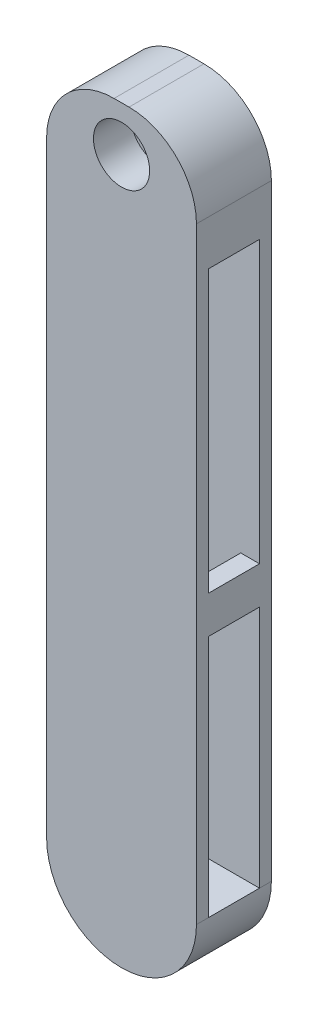
from build123d import *

# Parameters (mm, degrees)
SKETCH2_W           = 40
SKETCH2_H           = 200
BOSS_EXTRUDE1_DEPTH = 20
SKETCH3_R           = 2
CUT_EXTRUDE1_DEPTH  = 10
FILLET1_R           = 20
SKETCH5_R           = 7.5
CUT_EXTRUDE3_DEPTH  = 10
FILLET2_R           = 18
SKETCH6_W           = 13.65
SKETCH6_H           = 150
CUT_EXTRUDE4_DEPTH  = 110.544511501
SKETCH7_W           = 5
SKETCH7_H           = 10
BOSS_EXTRUDE2_DEPTH = 15


with BuildPart() as part:
    # Sketch2 → Boss-Extrude1 (new body)
    with BuildSketch(Plane.XY):
        Rectangle(SKETCH2_W, SKETCH2_H)
    extrude(amount=BOSS_EXTRUDE1_DEPTH)

    # Sketch3 → Cut-Extrude1 (cut)
    with BuildSketch(Plane(origin=(0, 0, 0), x_dir=(-1, 0, 0), z_dir=(0, 0, -1))):
        with Locations((0, -90)):
            Circle(SKETCH3_R)
    extrude(amount=-CUT_EXTRUDE1_DEPTH, mode=Mode.SUBTRACT)

    # Fillet1
    fillet1_edges = [part.edges().sort_by_distance(p)[0] for p in [
        (20, -100, 10),
        (-20, -100, 10),
    ]]
    fillet(fillet1_edges, radius=FILLET1_R - 0.0001)  # a hair under: the kernel refuses the full size

    # Sketch5 → Cut-Extrude3 (cut)
    with BuildSketch(Plane.XY.offset(20)):
        with Locations((0, 88)):
            Circle(SKETCH5_R)
    extrude(amount=-CUT_EXTRUDE3_DEPTH, mode=Mode.SUBTRACT)

    # Fillet2
    fillet2_edges = [part.edges().sort_by_distance(p)[0] for p in [
        (-20, 100, 10),
        (20, 100, 10),
    ]]
    fillet(fillet2_edges, radius=FILLET2_R)

    # Sketch6 → Cut-Extrude4 (cut, through all)
    with BuildSketch(Plane.ZY.offset(20)):
        with Locations((10, -5)):
            Rectangle(SKETCH6_W, SKETCH6_H)
    extrude(amount=-CUT_EXTRUDE4_DEPTH, mode=Mode.SUBTRACT)

    # Sketch7 → Boss-Extrude2 (add)
    with BuildSketch(Plane(origin=(0, 0, 16.825), x_dir=(-1, 0, 0), z_dir=(0, 0, -1))):
        with Locations((17.5, -10)):
            Rectangle(SKETCH7_W, SKETCH7_H)
    boss_extrude2 = extrude(amount=BOSS_EXTRUDE2_DEPTH)

    # Mirror1: Boss-Extrude2 across plane
    add(boss_extrude2.mirror(Plane(origin=(0, 0, 0), x_dir=(0, 0, 1), z_dir=(1, 0, 0))))


solid = part.part
